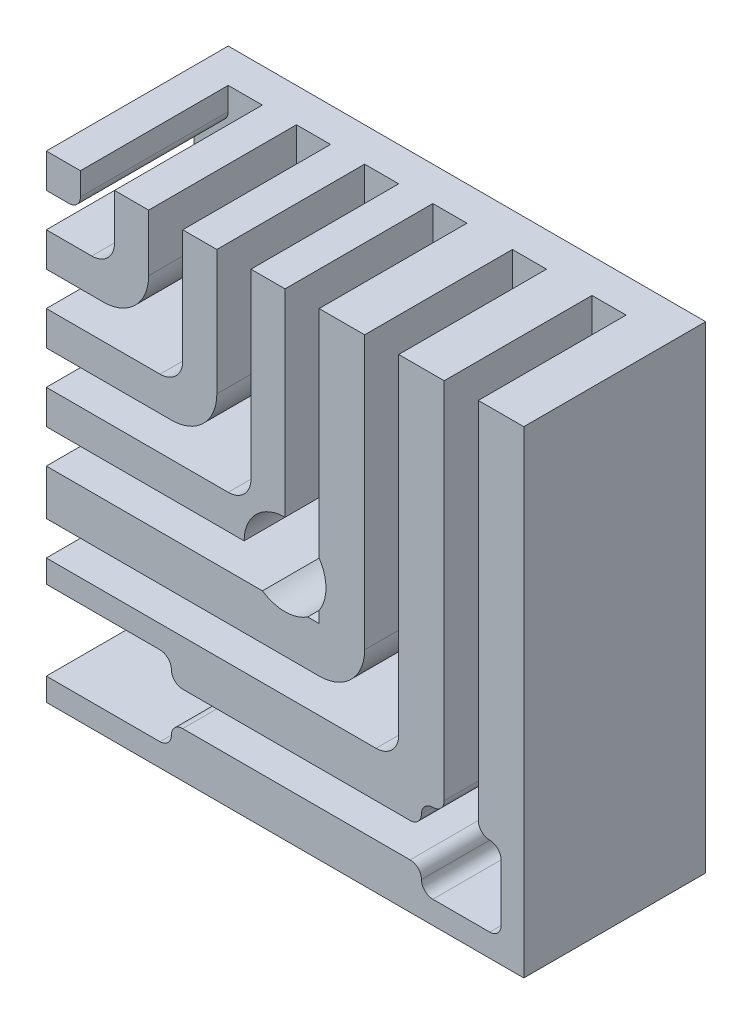
from build123d import *

# Parameters (mm, degrees)
SKETCH1_W           = 42
SKETCH1_H           = 42
BOSS_EXTRUDE1_DEPTH = 16
CUT_EXTRUDE1_DEPTH  = 13
SKETCH3_R           = 3.6
SKETCH3_R_2         = 1.6
CUT_EXTRUDE2_DEPTH  = 62.514225997
SKETCH4_W           = 11
SKETCH4_H           = 7
SKETCH4_W_2         = 7
CUT_EXTRUDE3_DEPTH  = 61.802960454
FILLET2_R           = 1
FILLET3_R           = 4
FILLET4_R           = 4
FILLET5_R           = 4
FILLET6_R           = 1
FILLET7_R           = 1
FILLET8_R           = 1
FILLET10_R          = 1
FILLET11_R          = 1
FILLET12_R          = 1
FILLET13_R          = 1
FILLET14_R          = 1
FILLET15_R          = 1
FILLET16_R          = 1
FILLET17_R          = 1
FILLET18_R          = 1
FILLET19_R          = 2
FILLET20_R          = 2
FILLET21_R          = 2
FILLET22_R          = 2


with BuildPart() as part:
    # Sketch1 → Boss-Extrude1 (new body)
    with BuildSketch(Plane.XY):
        with Locations((21, 21)):
            Rectangle(SKETCH1_W, SKETCH1_H)
    extrude(amount=BOSS_EXTRUDE1_DEPTH)

    # Sketch2 → Cut-Extrude1 (cut)
    with BuildSketch(Plane.XY.offset(16)):
        Polygon((3, 42), (3, 39), (0, 39), (0, 36), (6, 36), (6, 42), align=None)
        Polygon((9, 42), (9, 33), (0, 33), (0, 30), (12, 30), (12, 42), align=None)
        Polygon((15, 42), (15, 27), (0, 27), (0, 24), (18, 24), (18, 42), align=None)
        Polygon((0, 21), (21, 21), (21, 42), (24, 42), (24, 18), (0, 18), align=None)
        Polygon((28, 42), (28, 14), (0, 14), (0, 11), (31, 11), (31, 42), align=None)
        Polygon((35, 42), (35, 7), (0, 7), (0, 4), (38, 4), (38, 42), align=None)
    extrude(amount=-CUT_EXTRUDE1_DEPTH, mode=Mode.SUBTRACT)

    # Sketch3 → Cut-Extrude2 (cut, through all)
    with BuildSketch(Plane(origin=(0, 0, 0), x_dir=(-1, 0, 0), z_dir=(0, 0, -1))):
        with Locations((-21, 21)):
            Circle(SKETCH3_R)
        with Locations((-5.5, 5.5)):
            Circle(SKETCH3_R_2)
        with Locations((-36.5, 5.5)):
            Circle(SKETCH3_R_2)
    extrude(amount=-CUT_EXTRUDE2_DEPTH, mode=Mode.SUBTRACT)

    # Sketch4 → Cut-Extrude3 (cut, through all)
    with BuildSketch(Plane.XY.offset(3)):
        with Locations((5.5, 5.5)):
            Rectangle(SKETCH4_W, SKETCH4_H)
        with Locations((36.5, 5.5)):
            Rectangle(SKETCH4_W_2, SKETCH4_H)
    extrude(amount=CUT_EXTRUDE3_DEPTH, mode=Mode.SUBTRACT)

    # Fillet2
    fillet2_edges = [part.edges().sort_by_distance(p)[0] for p in [
        (3, 39, 9.5),
    ]]
    fillet(fillet2_edges, radius=FILLET2_R)

    # Fillet3
    fillet3_edges = [part.edges().sort_by_distance(p)[0] for p in [
        (9, 33, 9.5),
    ]]
    fillet(fillet3_edges, radius=FILLET3_R)

    # Fillet4
    fillet4_edges = [part.edges().sort_by_distance(p)[0] for p in [
        (15, 27, 9.5),
    ]]
    fillet(fillet4_edges, radius=FILLET4_R)

    # Fillet5
    fillet5_edges = [part.edges().sort_by_distance(p)[0] for p in [
        (28, 14, 9.5),
    ]]
    fillet(fillet5_edges, radius=FILLET5_R)

    # Fillet6
    fillet6_edges = [part.edges().sort_by_distance(p)[0] for p in [
        (35, 9, 9.5),
    ]]
    fillet(fillet6_edges, radius=FILLET6_R)

    # Fillet7
    fillet7_edges = [part.edges().sort_by_distance(p)[0] for p in [
        (33, 7, 9.5),
    ]]
    fillet(fillet7_edges, radius=FILLET7_R)

    # Fillet8
    fillet8_edges = [part.edges().sort_by_distance(p)[0] for p in [
        (40, 2, 9.5),
    ]]
    fillet(fillet8_edges, radius=FILLET8_R)

    # Fillet10
    fillet10_edges = [part.edges().sort_by_distance(p)[0] for p in [
        (33, 9, 9.5),
    ]]
    fillet(fillet10_edges, radius=FILLET10_R - 0.0001)  # a hair under: the kernel refuses the full size

    # Fillet11
    fillet11_edges = [part.edges().sort_by_distance(p)[0] for p in [
        (38, 9, 9.5),
    ]]
    fillet(fillet11_edges, radius=FILLET11_R)

    # Fillet12
    fillet12_edges = [part.edges().sort_by_distance(p)[0] for p in [
        (40, 9, 9.5),
    ]]
    fillet(fillet12_edges, radius=FILLET12_R - 0.0001)  # a hair under: the kernel refuses the full size

    # Fillet13
    fillet13_edges = [part.edges().sort_by_distance(p)[0] for p in [
        (33, 2, 9.5),
    ]]
    fillet(fillet13_edges, radius=FILLET13_R)

    # Fillet14
    fillet14_edges = [part.edges().sort_by_distance(p)[0] for p in [
        (33, 4, 9.5),
    ]]
    fillet(fillet14_edges, radius=FILLET14_R - 0.0001)  # a hair under: the kernel refuses the full size

    # Fillet15
    fillet15_edges = [part.edges().sort_by_distance(p)[0] for p in [
        (11, 4, 9.5),
    ]]
    fillet(fillet15_edges, radius=FILLET15_R)

    # Fillet16
    fillet16_edges = [part.edges().sort_by_distance(p)[0] for p in [
        (11, 2, 9.5),
    ]]
    fillet(fillet16_edges, radius=FILLET16_R - 0.0001)  # a hair under: the kernel refuses the full size

    # Fillet17
    fillet17_edges = [part.edges().sort_by_distance(p)[0] for p in [
        (11, 7, 9.5),
    ]]
    fillet(fillet17_edges, radius=FILLET17_R)

    # Fillet18
    fillet18_edges = [part.edges().sort_by_distance(p)[0] for p in [
        (11, 9, 9.5),
    ]]
    fillet(fillet18_edges, radius=FILLET18_R - 0.0001)  # a hair under: the kernel refuses the full size

    # Fillet19
    fillet19_edges = [part.edges().sort_by_distance(p)[0] for p in [
        (6, 36, 9.5),
    ]]
    fillet(fillet19_edges, radius=FILLET19_R)

    # Fillet20
    fillet20_edges = [part.edges().sort_by_distance(p)[0] for p in [
        (12, 30, 9.5),
    ]]
    fillet(fillet20_edges, radius=FILLET20_R)

    # Fillet21
    fillet21_edges = [part.edges().sort_by_distance(p)[0] for p in [
        (18, 24, 9.5),
    ]]
    fillet(fillet21_edges, radius=FILLET21_R)

    # Fillet22
    fillet22_edges = [part.edges().sort_by_distance(p)[0] for p in [
        (31, 11, 9.5),
    ]]
    fillet(fillet22_edges, radius=FILLET22_R)


solid = part.part
